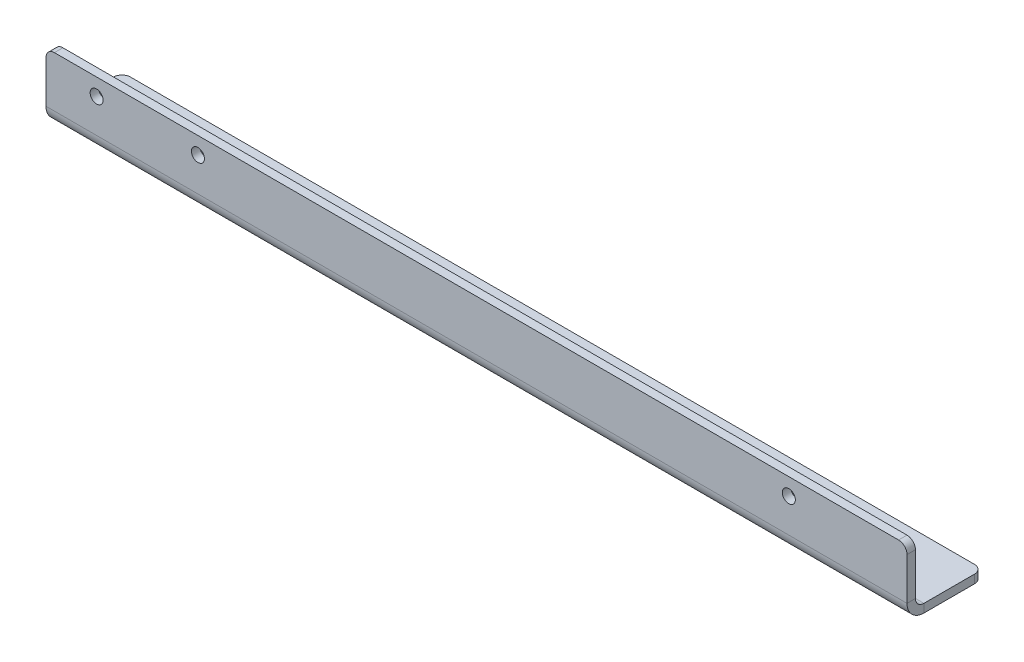
from build123d import *

# Parameters (mm, degrees)
SKETCH9_W                    = 323.85
SKETCH9_H                    = 28.575
BASE_FLANGE2_DEPTH           = 3.175
EDGE_FLANGE1_STRIP_W         = 19.05
EDGE_FLANGE1_STRIP_H         = 3.175
EDGE_FLANGE1_STRIP_CUT_DEPTH = 323.85
EDGE_FLANGE1_DEPTH           = 323.85
SKETCH15_R                   = 2.4511
CUT_EXTRUDE1_DEPTH           = 3.175
FILLET1_R                    = 3.175
SKETCH16_R                   = 2.4511
CUT_EXTRUDE2_DEPTH           = 3.175


# Sheet-metal steps are written as plain solids
with BuildPart() as part:
    # Sketch9 → Base-Flange2 (new body)
    with BuildSketch(Plane(origin=(0, 0, 0), x_dir=(1, 0, 0), z_dir=(0, 1, 0))):
        with Locations((161.925, 14.2875)):
            Rectangle(SKETCH9_W, SKETCH9_H)
    extrude(amount=-BASE_FLANGE2_DEPTH)

    # Edge-Flange1 strip (across the edge) → Edge-Flange1 strip cut (cut)
    with BuildSketch(Plane(origin=(0, 0, 0), x_dir=(0, 0, -1), z_dir=(1, 0, 0))):
        with Locations((-3.175, -1.5875)):
            Rectangle(EDGE_FLANGE1_STRIP_W, EDGE_FLANGE1_STRIP_H)
    extrude(amount=EDGE_FLANGE1_STRIP_CUT_DEPTH, mode=Mode.SUBTRACT)

    # Edge-Flange1 section (across the edge) → Edge-Flange1 (add)
    with BuildSketch(Plane(origin=(0, 0, 0), x_dir=(0, 0, -1), z_dir=(1, 0, 0))):
        with BuildLine():
            Line((0, 3.175), (0, 22.225))
            Line((0, 22.225), (3.175, 22.225))
            Line((3.175, 22.225), (3.175, 3.175))
            ThreePointArc((3.175, 3.175), (4.10493597, 0.92993597), (6.35, 0))
            Line((6.35, 0), (6.35, -3.175))
            ThreePointArc((6.35, -3.175), (1.859871939, -1.315128061), (0, 3.175))
        make_face()
    extrude(amount=EDGE_FLANGE1_DEPTH)

    # Sketch15 → Cut-Extrude1 (cut)
    with BuildSketch(Plane(origin=(0, 0, 0), x_dir=(1, 0, 0), z_dir=(0, 1, 0))):
        with Locations(Location((19.05, 19.05, 0), (0, 0, 270))):
            Circle(SKETCH15_R)
        with Locations(Location((57.15, 19.05, 0), (0, 0, 270))):
            Circle(SKETCH15_R)
        with Locations(Location((279.4, 19.05, 0), (0, 0, 270))):
            Circle(SKETCH15_R)
        with Locations((501.65, 19.05)):
            Circle(SKETCH15_R)
    extrude(amount=-CUT_EXTRUDE1_DEPTH, mode=Mode.SUBTRACT)

    # Fillet1
    fillet1_edges = [part.edges().sort_by_distance(p)[0] for p in [
        (0, 22.225, -1.5875),
        (323.85, 22.225, -1.5875),
        (0, -1.5875, -28.575),
        (323.85, -1.5875, -28.575),
    ]]
    fillet(fillet1_edges, radius=FILLET1_R)

    # Sketch16 → Cut-Extrude2 (cut)
    with BuildSketch(Plane.XY):
        with Locations((19.05, 15.875)):
            Circle(SKETCH16_R)
        with Locations((57.15, 15.875)):
            Circle(SKETCH16_R)
        with Locations((279.4, 15.875)):
            Circle(SKETCH16_R)
    extrude(amount=-CUT_EXTRUDE2_DEPTH, mode=Mode.SUBTRACT)


solid = part.part
